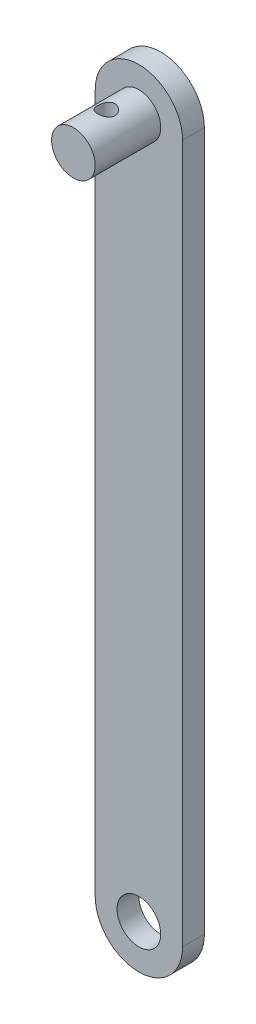
from build123d import *

# Parameters (mm, degrees)
SKETCH1_R           = 6.35
BOSS_EXTRUDE1_DEPTH = 6.35
SKETCH2_R           = 6.35
BOSS_EXTRUDE3_DEPTH = 25.4
SKETCH5_R           = 2.54
CUT_EXTRUDE2_DEPTH  = 118.774954893


with BuildPart() as part:
    # Sketch1 → Boss-Extrude1 (new body)
    with BuildSketch(Plane.XY):
        with BuildLine():
            Line((-12.7, -101.6), (-12.7, 101.6))
            ThreePointArc((-12.7, 101.6), (0, 114.3), (12.7, 101.6))
            Line((12.7, 101.6), (12.7, -101.6))
            ThreePointArc((12.7, -101.6), (0, -114.3), (-12.7, -101.6))
        make_face()
        with Locations((0, 101.6)):
            Circle(SKETCH1_R, mode=Mode.SUBTRACT)
        with Locations((0, -101.6)):
            Circle(SKETCH1_R, mode=Mode.SUBTRACT)
    extrude(amount=BOSS_EXTRUDE1_DEPTH)

    # Sketch2 → Boss-Extrude3 (add)
    with BuildSketch(Plane.XY):
        with Locations((0, 101.6)):
            Circle(SKETCH2_R)
    extrude(amount=BOSS_EXTRUDE3_DEPTH)

    # Sketch5 → Cut-Extrude2 (cut, through all)
    with BuildSketch(Plane(origin=(0, 0, 0), x_dir=(1, 0, 0), z_dir=(0, 1, 0))):
        with Locations((0, -15.875)):
            Circle(SKETCH5_R)
    extrude(amount=CUT_EXTRUDE2_DEPTH, mode=Mode.SUBTRACT)


solid = part.part
